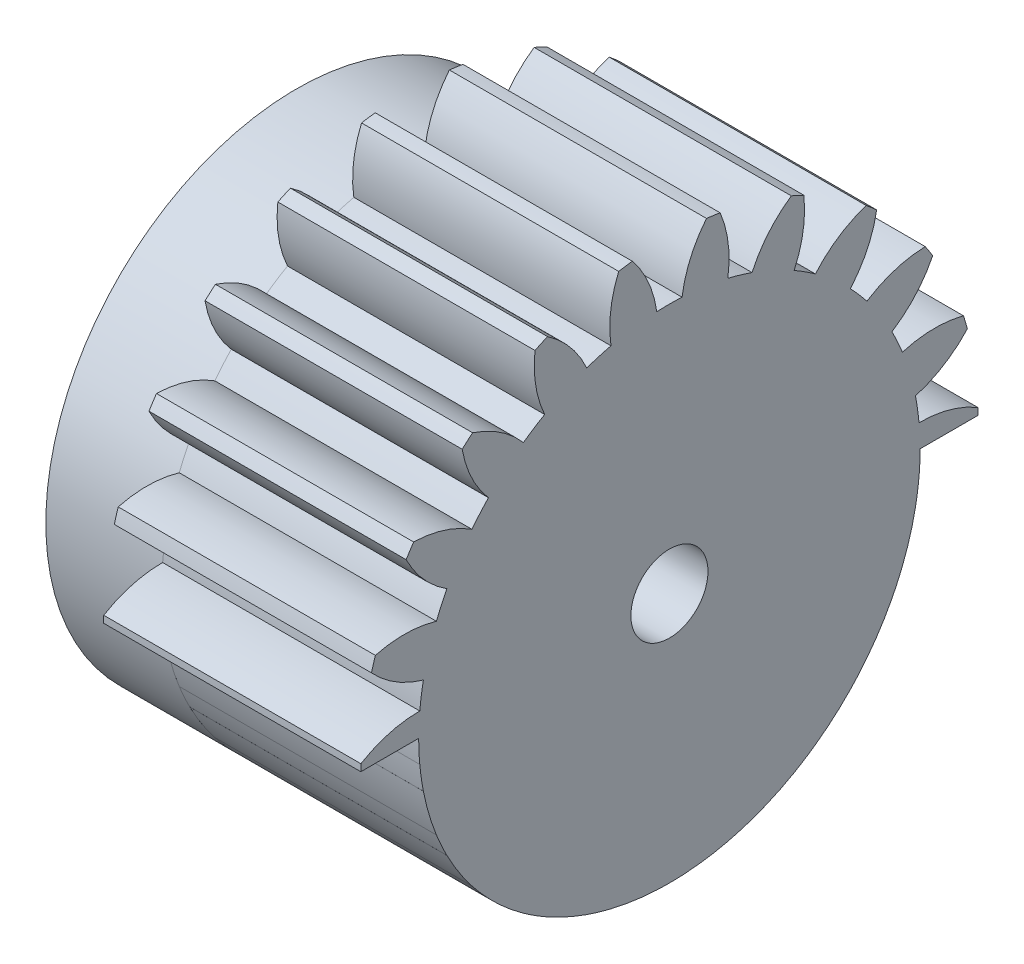
from build123d import *

# Parameters (mm, degrees)
SKETCH5_R           = 1.5
BOSS_EXTRUDE1_DEPTH = 10
SKETCH10_W          = 4.5
SKETCH10_H          = 6.3
CUT_EXTRUDE1_DEPTH  = 10


with BuildPart() as part:
    # Sketch5 → Boss-Extrude1 (new body)
    with BuildSketch(Plane(origin=(4.038890567, 0, 0), x_dir=(0, 0, -1), z_dir=(1, 0, 0))):
        with BuildLine():
            ThreePointArc((-8.767047038, 4.183890551), (-7.665653193, 3.710793481), (-6.477446097, 3.552511658))
            ThreePointArc((-6.477446097, 3.552511658), (-6.419815651, 3.06474668), (-6.337692385, 2.580503238))
            ThreePointArc((-6.337692385, 2.580503238), (-7.433175602, 2.093876318), (-8.35666841, 1.329644499))
            ThreePointArc((-8.35666841, 1.329644499), (-8.283962098, 1.071383356), (-8.205500024, 0.814812257))
            ThreePointArc((-8.205500024, 0.814812257), (-7.015433522, 0.671177447), (-5.830764019, 0.854063773))
            ThreePointArc((-5.830764019, 0.854063773), (-5.638048737, 0.402293077), (-5.422824897, -0.039198306))
            ThreePointArc((-5.422824897, -0.039198306), (-6.3368347, -0.814746704), (-7.007610576, -1.808199754))
            ThreePointArc((-7.007610576, -1.808199754), (-6.865088808, -2.035515771), (-6.717520569, -2.259588617))
            ThreePointArc((-6.717520569, -2.259588617), (-5.535193519, -2.06212473), (-4.450036487, -1.552886617))
            ThreePointArc((-4.450036487, -1.552886617), (-4.137849015, -1.932063257), (-3.806960756, -2.295035573))
            ThreePointArc((-3.806960756, -2.295035573), (-4.465449507, -3.296675131), (-4.829166179, -4.438865755))
            ThreePointArc((-4.829166179, -4.438865755), (-4.628375221, -4.616820854), (-4.423655917, -4.790242398))
            ThreePointArc((-4.423655917, -4.790242398), (-3.344853426, -4.267677163), (-2.447121834, -3.473342707))
            ThreePointArc((-2.447121834, -3.473342707), (-2.040753744, -3.749206653), (-1.621007666, -4.004254045))
            ThreePointArc((-1.621007666, -4.004254045), (-1.970628521, -5.150837883), (-1.997819828, -6.349232589))
            ThreePointArc((-1.997819828, -6.349232589), (-1.75502657, -6.463409906), (-1.50974134, -6.572130566))
            ThreePointArc((-1.50974134, -6.572130566), (-0.62186157, -5.76679911), (0.015715707, -4.751720564))
            ThreePointArc((0.015715707, -4.751720564), (0.483342889, -4.901922961), (0.957941455, -5.028383006))
            ThreePointArc((0.957941455, -5.028383006), (0.945512697, -6.22702172), (1.257049634, -7.384533696))
            ThreePointArc((1.257049634, -7.384533696), (1.522175527, -7.425683264), (1.788155131, -7.460895139))
            ThreePointArc((1.788155131, -7.460895139), (2.413181441, -6.438040628), (2.738951684, -5.284453619))
            ThreePointArc((2.738951684, -5.284453619), (3.229953586, -5.296825962), (3.720955487, -5.284453619))
            ThreePointArc((3.720955487, -5.284453619), (4.04672573, -6.438040628), (4.671752041, -7.460895139))
            ThreePointArc((4.671752041, -7.460895139), (4.937731645, -7.425683264), (5.202857538, -7.384533696))
            ThreePointArc((5.202857538, -7.384533696), (5.514394474, -6.22702172), (5.501965716, -5.028383006))
            ThreePointArc((5.501965716, -5.028383006), (5.976564282, -4.901922961), (6.444191465, -4.751720564))
            ThreePointArc((6.444191465, -4.751720564), (7.081768742, -5.76679911), (7.969648512, -6.572130566))
            ThreePointArc((7.969648512, -6.572130566), (8.214933742, -6.463409906), (8.457727, -6.349232589))
            ThreePointArc((8.457727, -6.349232589), (8.430535693, -5.150837883), (8.080914837, -4.004254045))
            ThreePointArc((8.080914837, -4.004254045), (8.500660915, -3.749206653), (8.907029006, -3.473342707))
            ThreePointArc((8.907029006, -3.473342707), (9.804760597, -4.267677163), (10.883563088, -4.790242398))
            ThreePointArc((10.883563088, -4.790242398), (11.088282393, -4.616820854), (11.289073351, -4.438865755))
            ThreePointArc((11.289073351, -4.438865755), (10.925356678, -3.296675131), (10.266867928, -2.295035573))
            ThreePointArc((10.266867928, -2.295035573), (10.597756186, -1.932063257), (10.909943659, -1.552886617))
            ThreePointArc((10.909943659, -1.552886617), (11.995100691, -2.06212473), (13.17742774, -2.259588617))
            ThreePointArc((13.17742774, -2.259588617), (13.32499598, -2.035515771), (13.467517748, -1.808199754))
            ThreePointArc((13.467517748, -1.808199754), (12.796741871, -0.814746704), (11.882732068, -0.039198306))
            ThreePointArc((11.882732068, -0.039198306), (12.097955909, 0.402293077), (12.290671191, 0.854063773))
            ThreePointArc((12.290671191, 0.854063773), (13.475340694, 0.671177447), (14.665407196, 0.814812257))
            ThreePointArc((14.665407196, 0.814812257), (14.743869269, 1.071383356), (14.816575582, 1.329644499))
            ThreePointArc((14.816575582, 1.329644499), (13.893082774, 2.093876318), (12.797599556, 2.580503238))
            ThreePointArc((12.797599556, 2.580503238), (12.879722823, 3.06474668), (12.937353269, 3.552511658))
            ThreePointArc((12.937353269, 3.552511658), (14.125560365, 3.710793481), (15.22695421, 4.183890551))
            ThreePointArc((15.22695421, 4.183890551), (15.229953586, 4.452174038), (15.22695421, 4.720457526))
            ThreePointArc((15.22695421, 4.720457526), (14.125560365, 5.193554596), (12.937353269, 5.351836419))
            ThreePointArc((12.937353269, 5.351836419), (12.879722823, 5.839601397), (12.797599556, 6.323844839))
            ThreePointArc((12.797599556, 6.323844839), (13.893082774, 6.810471759), (14.816575582, 7.574703578))
            ThreePointArc((14.816575582, 7.574703578), (14.743869269, 7.832964721), (14.665407196, 8.08953582))
            ThreePointArc((14.665407196, 8.08953582), (13.475340694, 8.23317063), (12.290671191, 8.050284304))
            ThreePointArc((12.290671191, 8.050284304), (12.097955909, 8.502055), (11.882732068, 8.943546382))
            ThreePointArc((11.882732068, 8.943546382), (12.796741871, 9.719094781), (13.467517748, 10.712547831))
            ThreePointArc((13.467517748, 10.712547831), (13.32499598, 10.939863848), (13.17742774, 11.163936694))
            ThreePointArc((13.17742774, 11.163936694), (11.995100691, 10.966472807), (10.909943659, 10.457234694))
            ThreePointArc((10.909943659, 10.457234694), (10.597756186, 10.836411334), (10.266867928, 11.19938365))
            ThreePointArc((10.266867928, 11.19938365), (10.925356678, 12.201023208), (11.289073351, 13.343213832))
            ThreePointArc((11.289073351, 13.343213832), (11.088282393, 13.521168931), (10.883563088, 13.694590475))
            ThreePointArc((10.883563088, 13.694590475), (9.804760597, 13.17202524), (8.907029006, 12.377690783))
            ThreePointArc((8.907029006, 12.377690783), (8.500660915, 12.65355473), (8.080914837, 12.908602122))
            ThreePointArc((8.080914837, 12.908602122), (8.430535693, 14.05518596), (8.457727, 15.253580666))
            ThreePointArc((8.457727, 15.253580666), (8.214933742, 15.367757983), (7.969648512, 15.476478643))
            ThreePointArc((7.969648512, 15.476478643), (7.081768742, 14.671147187), (6.444191465, 13.656068641))
            ThreePointArc((6.444191465, 13.656068641), (5.976564282, 13.806271038), (5.501965716, 13.932731083))
            ThreePointArc((5.501965716, 13.932731083), (5.514394474, 15.131369796), (5.202857538, 16.288881773))
            ThreePointArc((5.202857538, 16.288881773), (4.937731645, 16.330031341), (4.671752041, 16.365243215))
            ThreePointArc((4.671752041, 16.365243215), (4.04672573, 15.342388705), (3.720955487, 14.188801696))
            ThreePointArc((3.720955487, 14.188801696), (3.229953586, 14.201174038), (2.738951684, 14.188801696))
            ThreePointArc((2.738951684, 14.188801696), (2.413181441, 15.342388705), (1.788155131, 16.365243215))
            ThreePointArc((1.788155131, 16.365243215), (1.522175527, 16.330031341), (1.257049634, 16.288881773))
            ThreePointArc((1.257049634, 16.288881773), (0.945512697, 15.131369796), (0.957941455, 13.932731083))
            ThreePointArc((0.957941455, 13.932731083), (0.483342889, 13.806271038), (0.015715707, 13.656068641))
            ThreePointArc((0.015715707, 13.656068641), (-0.62186157, 14.671147187), (-1.50974134, 15.476478643))
            ThreePointArc((-1.50974134, 15.476478643), (-1.75502657, 15.367757983), (-1.997819828, 15.253580666))
            ThreePointArc((-1.997819828, 15.253580666), (-1.970628521, 14.05518596), (-1.621007666, 12.908602122))
            ThreePointArc((-1.621007666, 12.908602122), (-2.040753744, 12.65355473), (-2.447121834, 12.377690783))
            ThreePointArc((-2.447121834, 12.377690783), (-3.344853426, 13.17202524), (-4.423655917, 13.694590475))
            ThreePointArc((-4.423655917, 13.694590475), (-4.628375221, 13.521168931), (-4.829166179, 13.343213832))
            ThreePointArc((-4.829166179, 13.343213832), (-4.465449507, 12.201023208), (-3.806960756, 11.19938365))
            ThreePointArc((-3.806960756, 11.19938365), (-4.137849015, 10.836411334), (-4.450036487, 10.457234694))
            ThreePointArc((-4.450036487, 10.457234694), (-5.535193519, 10.966472807), (-6.717520569, 11.163936694))
            ThreePointArc((-6.717520569, 11.163936694), (-6.865088808, 10.939863848), (-7.007610576, 10.712547831))
            ThreePointArc((-7.007610576, 10.712547831), (-6.3368347, 9.719094781), (-5.422824897, 8.943546382))
            ThreePointArc((-5.422824897, 8.943546382), (-5.638048737, 8.502055), (-5.830764019, 8.050284304))
            ThreePointArc((-5.830764019, 8.050284304), (-7.015433522, 8.23317063), (-8.205500024, 8.08953582))
            ThreePointArc((-8.205500024, 8.08953582), (-8.283962098, 7.832964721), (-8.35666841, 7.574703578))
            ThreePointArc((-8.35666841, 7.574703578), (-7.433175602, 6.810471759), (-6.337692385, 6.323844839))
            ThreePointArc((-6.337692385, 6.323844839), (-6.419815651, 5.839601397), (-6.477446097, 5.351836419))
            ThreePointArc((-6.477446097, 5.351836419), (-7.665653193, 5.193554596), (-8.767047038, 4.720457526))
            ThreePointArc((-8.767047038, 4.720457526), (-8.770046414, 4.452174038), (-8.767047038, 4.183890551))
        make_face()
        with Locations((3.229953586, 4.452174038)):
            Circle(SKETCH5_R, mode=Mode.SUBTRACT)
    extrude(amount=-BOSS_EXTRUDE1_DEPTH)

    # Sketch11 → Cut-Extrude1 (cut)
    with BuildSketch(Plane(origin=(4.038890567, 0, 0), x_dir=(0, 0, -1), z_dir=(1, 0, 0))):
        with BuildLine():
            Line((-9.270046414, 4.452174038), (-6.520046414, 4.452174038))
            ThreePointArc((-6.520046414, 4.452174038), (3.229953586, -5.297825962), (12.979953586, 4.452174038))
            Line((12.979953586, 4.452174038), (15.729953586, 4.452174038))
            ThreePointArc((15.729953586, 4.452174038), (3.229953586, -8.047825962), (-9.270046414, 4.452174038))
        make_face()
    extrude(amount=-CUT_EXTRUDE1_DEPTH, mode=Mode.SUBTRACT)


with BuildPart() as body_2:
    # Sketch10 → Revolve2 (revolve)
    with BuildSketch(Plane.XY.offset(-3.229953586)):
        with Locations((-8.211109433, 11.052174038)):
            Rectangle(SKETCH10_W, SKETCH10_H)
    revolve(axis=Axis((-10.461109433, 4.452174038, -3.229953586), (1, 0, 0)))


solid = Compound([part.part, body_2.part])
